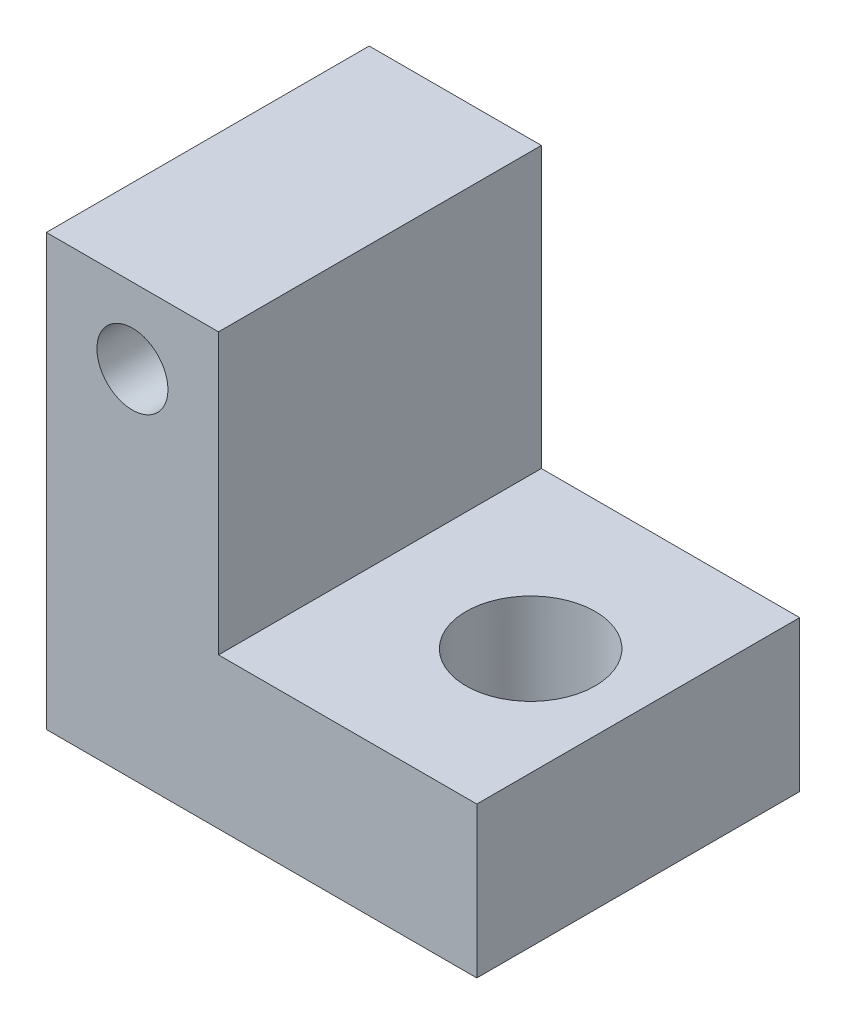
from build123d import *

# Parameters (mm, degrees)
ESTRUSIONE_ESTRUSIONE1_DEPTH = 15
SCHIZZO2_R                   = 3
TAGLIO_ESTRUSIONE1_DEPTH     = 15
FORO_FILETTATO_M4_1_D        = 3.3


with BuildPart() as part:
    # Schizzo1 → Estrusione-Estrusione1 (new body)
    with BuildSketch(Plane.XY):
        Polygon((0, 0), (-20, 0), (-20, 20), (-12, 20), (-12, 7), (0, 7), align=None)
    extrude(amount=ESTRUSIONE_ESTRUSIONE1_DEPTH)

    # Schizzo2 → Taglio-Estrusione1 (cut)
    with BuildSketch(Plane.XZ):
        with Locations((-5, 7.5)):
            Circle(SCHIZZO2_R)
    extrude(amount=-TAGLIO_ESTRUSIONE1_DEPTH, mode=Mode.SUBTRACT)

    # Foro filettato M4-1 (through all)
    with Locations(Plane.XY.offset(15)):
        with Locations((-16, 16.5)):
            Hole(FORO_FILETTATO_M4_1_D / 2)


solid = part.part
